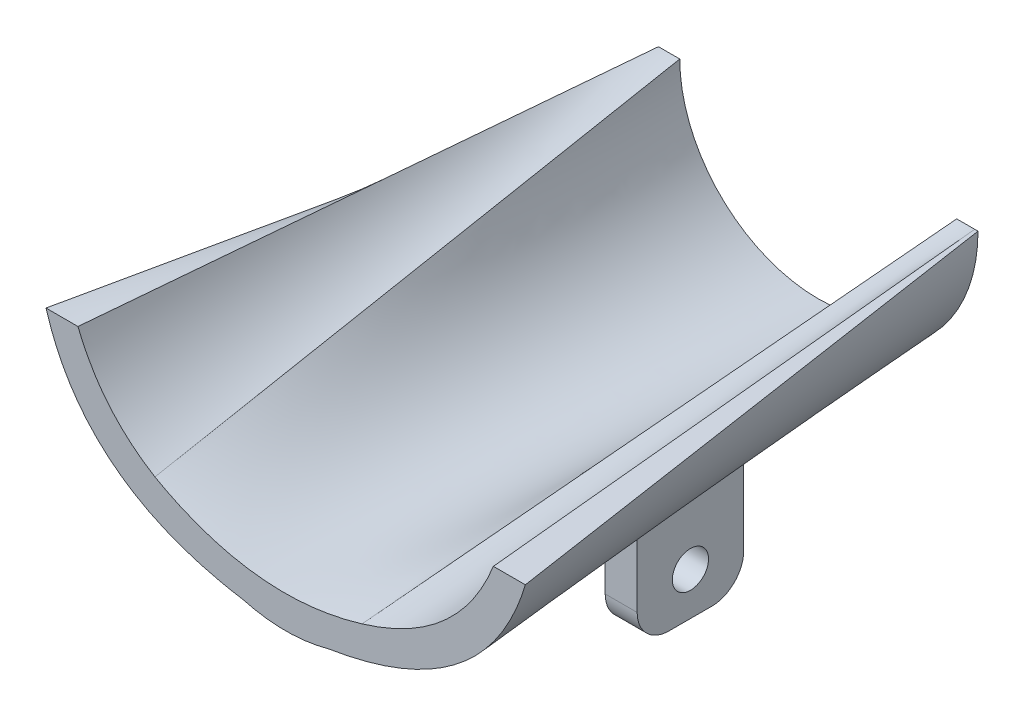
from build123d import *

# Parameters (mm, degrees)
Y_KSEKLIK_EKSTR_ZYON1_DEPTH      = 1
Y_KSEKLIK_EKSTR_ZYON1_DEPTH_BACK = 12
IZIM3_W                          = 3
IZIM3_H                          = 10
RADYUS1_R                        = 3
IZIM4_R                          = 1.7
KES_EKSTR_ZYON1_DEPTH            = 31


with BuildPart() as part:
    # Loft1: read off the stored shape, not the designer's step
    # Loft1: loft between two sections, ruled curve by curve
    loft1_from = [
        Edge.make_bspline([(-13, 0, 0), (-13.209224756, 0, 0), (-13.54255809, 0, 0), (-13.875891423, 0, 0), (-14.101661333, 0, 0), (-14.434994666, 0, 0), (-14.768328, 0, 0), (-15, 0, 0)], [0, 0, 0, 0, 0.313837134, 0.5, 0.5, 0.652492, 1, 1, 1, 1], 3),
        Edge.make_bspline([(-15, 0, 0), (-15, -0.406070992, 0), (-14.983401695, -0.812808246, 0), (-14.917335296, -1.623604412, 0), (-14.867867201, -2.027663325, 0), (-14.80212762, -2.428377634, 0)], [0, 0, 0, 0, 0.5, 0.5, 1, 1, 1, 1], 3),
        Edge.make_bspline([(13, 0, 0), (13, -0.541666667, 0), (12.966403007, -1.117524212, 0), (12.803508497, -2.333803221, 0), (12.674133333, -2.9744, 0), (12.285866667, -4.3056, 0), (12.026764297, -4.996380928, 0), (11.344022219, -6.396877499, 0), (10.92, -7.106666667, 0), (9.88, -8.493333333, 0), (9.263526615, -9.170013136, 0), (7.832363796, -10.41902796, 0), (7.017301038, -10.99077278, 0), (5.21799308, -11.950403691, 0), (4.233846154, -12.337435897, 0), (2.166153846, -12.862564103, 0), (1.083333333, -13, 0), (-1.083333333, -13, 0), (-2.166153846, -12.862564103, 0), (-4.233846154, -12.337435897, 0), (-5.21799308, -11.950403691, 0), (-7.017301038, -10.99077278, 0), (-7.832363796, -10.41902796, 0), (-9.263526615, -9.170013136, 0), (-9.88, -8.493333333, 0), (-10.92, -7.106666667, 0), (-11.344022219, -6.396877499, 0), (-12.026764297, -4.996380928, 0), (-12.285866667, -4.3056, 0), (-12.674133333, -2.9744, 0), (-12.803508497, -2.333803221, 0), (-12.966403007, -1.117524212, 0), (-13, -0.541666667, 0), (-13, 0, 0)], [0, 0, 0, 0, 0.0625, 0.0625, 0.125, 0.125, 0.1875, 0.1875, 0.25, 0.25, 0.3125, 0.3125, 0.375, 0.375, 0.4375, 0.4375, 0.5, 0.5, 0.5625, 0.5625, 0.625, 0.625, 0.6875, 0.6875, 0.75, 0.75, 0.8125, 0.8125, 0.875, 0.875, 0.9375, 0.9375, 1, 1, 1, 1], 3),
        Edge.make_bspline([(-14.80212762, -2.428377634, 0), (-14.681938937, -3.16098536, 0), (-14.504127476, -3.902792163, 0), (-14.02427913, -5.377833707, 0), (-13.722166884, -6.11096882, 0), (-12.993207628, -7.537795397, 0), (-12.566336555, -8.231351462, 0), (-11.597614897, -9.547946899, 0), (-11.055808561, -10.170847244, 0), (-9.876980677, -11.319111684, 0), (-9.240065749, -11.844371923, 0), (-7.898482942, -12.778181737, 0), (-7.193955206, -13.18669073, 0), (-5.748476154, -13.877925848, 0), (-5.007659558, -14.160679583, 0), (-3.520524561, -14.601623448, 0), (-2.774303774, -14.75989153, 0), (-2.038792236, -14.860798304, 0)], [0, 0, 0, 0, 0.125, 0.125, 0.25, 0.25, 0.375, 0.375, 0.5, 0.5, 0.625, 0.625, 0.75, 0.75, 0.875, 0.875, 1, 1, 1, 1], 3),
        Edge.make_bspline([(-2.038792236, -14.860798304, 0), (0.134662487, -15.158980307, 0), (2.321229161, -14.980811498, 0), (4.417739539, -14.33469837, 0)], [0, 0, 0, 0, 1, 1, 1, 1], 3, [1, 0.984272414, 0.984272414, 1]),
        Edge.make_bspline([(4.417739539, -14.33469837, 0), (5.127212599, -14.116049389, 0), (5.83796731, -13.839062041, 0), (7.234099562, -13.16317986, 0), (7.919368159, -12.764223905, 0), (9.233873859, -11.848095943, 0), (9.86297355, -11.3309185, 0), (11.035682686, -10.192235719, 0), (11.579160408, -9.570793115, 0), (12.556543149, -8.246833378, 0), (12.990359766, -7.544435992, 0), (13.733156479, -6.088380279, 0), (14.042115417, -5.334866309, 0), (14.53046703, -3.808849147, 0), (14.70990537, -3.036475671, 0), (14.944626607, -1.503208594, 0), (15, -0.742401104, 0), (15, 0, 0)], [0, 0, 0, 0, 0.125, 0.125, 0.25, 0.25, 0.375, 0.375, 0.5, 0.5, 0.625, 0.625, 0.75, 0.75, 0.875, 0.875, 1, 1, 1, 1], 3),
        Edge.make_bspline([(14.691051451, 0, 0), (14.409209542, 0, 0), (14.127367634, 0, 0), (13.563683817, 0, 0), (13.281841908, 0, 0), (13, 0, 0)], [0, 0, 0, 0, 0.5, 0.5, 1, 1, 1, 1], 3),
        Edge.make_line((14.691051451, 0, 0), (15, 0, 0)),
    ]
    loft1_to = [
        Edge.make_bspline([(-12.275322713, -8.62069906, 50), (-13.30009489, -7.9994122, 50), (-14.838773196, -6.851542234, 50), (-16.153887151, -5.461933248, 50), (-16.982212381, -4.468717424, 50), (-18.129692881, -2.939391702, 50), (-19.010068808, -1.232828152, 50), (-19.501011098, 0, 50)], [0, 0, 0, 0, 0.313837134, 0.5, 0.5, 0.652492, 1, 1, 1, 1], 3),
        Edge.make_bspline([(-19.501011098, 0, 50), (-20.001011098, 0, 50), (-20.501011098, 0, 50), (-21.501011098, 0, 50), (-22.001011098, 0, 50), (-22.501011098, 0, 50)], [0, 0, 0, 0, 0.5, 0.5, 1, 1, 1, 1], 3),
        Edge.make_bspline([(7.170134264, -10.843854234, 50), (6.75061217, -10.971235531, 50), (6.331990602, -11.087760763, 50), (5.496548516, -11.2990991, 50), (5.079727998, -11.393912204, 50), (4.247888014, -11.561826283, 50), (3.832868547, -11.634927259, 50), (3.004630665, -11.75941708, 50), (2.591412249, -11.810805927, 50), (1.766776468, -11.891871491, 50), (1.355359103, -11.921548209, 50), (0.534325424, -11.959189516, 50), (0.12470911, -11.967154105, 50), (-0.692722467, -11.961371154, 50), (-1.100537731, -11.947623615, 50), (-1.914367207, -11.898416407, 50), (-2.320381419, -11.862956738, 50), (-3.130608793, -11.770325273, 50), (-3.534821955, -11.713153476, 50), (-4.341447227, -11.577097753, 50), (-4.743859338, -11.498213827, 50), (-5.546882508, -11.318733846, 50), (-5.947493568, -11.218137792, 50), (-6.746914637, -10.995233554, 50), (-7.145724646, -10.87292537, 50), (-7.941543614, -10.606596875, 50), (-8.338552572, -10.462576563, 50), (-9.130769437, -10.15282381, 50), (-9.525977345, -9.987091369, 50), (-10.314592108, -9.633914359, 50), (-10.707998965, -9.446469789, 50), (-11.493011627, -9.049868521, 50), (-11.884617433, -8.840711823, 50), (-12.275322713, -8.62069906, 50)], [0, 0, 0, 0, 0.0625, 0.0625, 0.125, 0.125, 0.1875, 0.1875, 0.25, 0.25, 0.3125, 0.3125, 0.375, 0.375, 0.4375, 0.4375, 0.5, 0.5, 0.5625, 0.5625, 0.625, 0.625, 0.6875, 0.6875, 0.75, 0.75, 0.8125, 0.8125, 0.875, 0.875, 0.9375, 0.9375, 1, 1, 1, 1], 3),
        Edge.make_bspline([(-22.501011098, 0, 50), (-22.201916292, -1.005484405, 50), (-21.843929165, -1.960557007, 50), (-21.010170267, -3.769878608, 50), (-20.534398496, -4.624127606, 50), (-19.465070311, -6.231801999, 50), (-18.871513898, -6.985227394, 50), (-17.566616427, -8.391254578, 50), (-16.85527537, -9.043856368, 50), (-15.314808613, -10.248236345, 50), (-14.485682914, -10.800014531, 50), (-12.709646871, -11.802747299, 50), (-11.762736528, -12.253701882, 50), (-9.751131199, -13.054787442, 50), (-8.686436212, -13.40491842, 50), (-6.439261597, -14.004356772, 50), (-5.256781968, -14.253664146, 50), (-4.015410017, -14.452559718, 50)], [0, 0, 0, 0, 0.125, 0.125, 0.25, 0.25, 0.375, 0.375, 0.5, 0.5, 0.625, 0.625, 0.75, 0.75, 0.875, 0.875, 1, 1, 1, 1], 3),
        Edge.make_bspline([(-4.015410017, -14.452559718, 50), (-1.371847999, -15.187030678, 50), (1.371847999, -15.187030678, 50), (4.015410017, -14.452559718, 50)], [0, 0, 0, 0, 1, 1, 1, 1], 3, [1, 0.975669321, 0.975669321, 1]),
        Edge.make_bspline([(4.015410017, -14.452559718, 50), (5.256781968, -14.253664146, 50), (6.439261597, -14.004356772, 50), (8.686436212, -13.40491842, 50), (9.751131199, -13.054787442, 50), (11.762736528, -12.253701882, 50), (12.709646871, -11.802747299, 50), (14.485682914, -10.800014531, 50), (15.314808613, -10.248236345, 50), (16.85527537, -9.043856368, 50), (17.566616427, -8.391254578, 50), (18.871513898, -6.985227394, 50), (19.465070311, -6.231801999, 50), (20.534398496, -4.624127606, 50), (21.010170267, -3.769878608, 50), (21.843929165, -1.960557007, 50), (22.201916292, -1.005484405, 50), (22.501011098, 0, 50)], [0, 0, 0, 0, 0.125, 0.125, 0.25, 0.25, 0.375, 0.375, 0.5, 0.5, 0.625, 0.625, 0.75, 0.75, 0.875, 0.875, 1, 1, 1, 1], 3),
        Edge.make_bspline([(19.501011098, 0, 50), (18.422591042, -2.708071054, 50), (16.855807944, -4.965761101, 50), (12.745515666, -8.580379179, 50), (10.202006485, -9.93730721, 50), (7.170134264, -10.843854234, 50)], [0, 0, 0, 0, 0.5, 0.5, 1, 1, 1, 1], 3),
        Edge.make_line((19.501011098, 0, 50), (22.501011098, 0, 50)),
    ]
    loft1 = Solid(Shell([*[Face.make_surface_from_curves(loft1_from[k], loft1_to[k]) for k in range(8)], Face(Wire(loft1_from)), Face(Wire(loft1_to))]))
    add(loft1)

    # Çizim3 → Yükseklik-Ekstrüzyon1 (add, two sides: drawn at the far end of the back side and taken through both)
    with BuildSketch(Plane(origin=(0, -15, 0), x_dir=(1, 0, 0), z_dir=(0, 1, 0)).offset(-Y_KSEKLIK_EKSTR_ZYON1_DEPTH_BACK)):
        with Locations((-4.5, -18)):
            Rectangle(IZIM3_W, IZIM3_H)
        with Locations((4.5, -18)):
            Rectangle(IZIM3_W, IZIM3_H)
    extrude(amount=Y_KSEKLIK_EKSTR_ZYON1_DEPTH + Y_KSEKLIK_EKSTR_ZYON1_DEPTH_BACK)

    # Radyus1
    radyus1_edges = [part.edges().sort_by_distance(p)[0] for p in [
        (4.5, -27, 23),
        (4.5, -27, 13),
        (-4.5, -27, 13),
        (-4.5, -27, 23),
    ]]
    fillet(radyus1_edges, radius=RADYUS1_R)

    # Çizim4 → Kes-Ekstrüzyon1 (cut)
    with BuildSketch(Plane.ZY.offset(6)):
        with Locations((18, -23)):
            Circle(IZIM4_R)
    extrude(amount=-KES_EKSTR_ZYON1_DEPTH, mode=Mode.SUBTRACT)


solid = part.part
